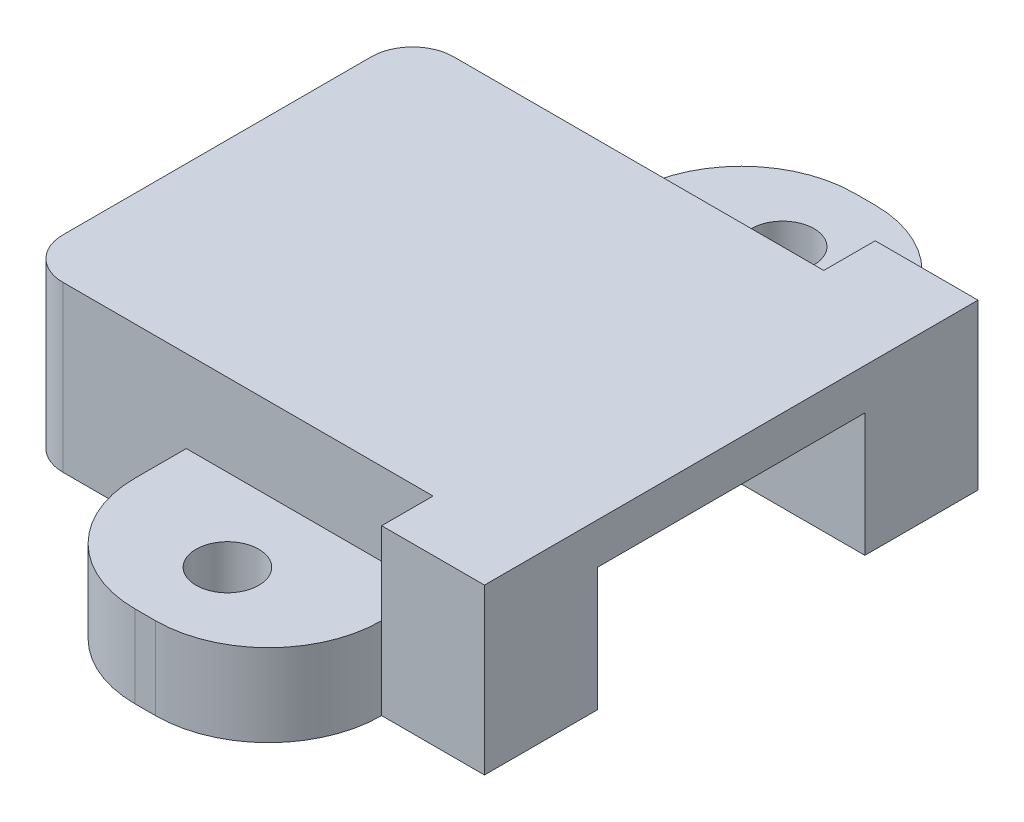
from build123d import *

# Parameters (mm, degrees)
SKETCH1_W           = 22
SKETCH1_H           = 13
BOSS_EXTRUDE1_DEPTH = 6
BOSS_EXTRUDE2_DEPTH = 2
BOSS_EXTRUDE3_DEPTH = 8
SKETCH4_R           = 1.525
SKETCH4_R_2         = 1.524
CUT_EXTRUDE1_DEPTH  = 36.566838488
SKETCH5_W           = 9
SKETCH5_H           = 4.088652256
CUT_EXTRUDE2_DEPTH  = 38.735924528
FILLET1_R           = 2
SKETCH6_W           = 12
SKETCH6_H           = 13.009000019
SKETCH6_W_2         = 15.838286437
CUT_EXTRUDE3_DEPTH  = 4
SKETCH7_W           = 2.5
SKETCH7_H           = 8
BOSS_EXTRUDE5_DEPTH = 3
FILLET3_R           = 2.5
FILLET4_R           = 2.5
SKETCH9_W           = 24
SKETCH9_H           = 8
CUT_EXTRUDE5_DEPTH  = 3
BOSS_EXTRUDE6_REACH = 35.526
SKETCH10_W          = 5
SKETCH10_H          = 2.5


with BuildPart() as part:
    # Sketch1 → Boss-Extrude1 (new body)
    with BuildSketch(Plane(origin=(0, 0, 0), x_dir=(1, 0, 0), z_dir=(0, 1, 0))):
        with BuildLine():
            Line((-1, -3), (23, -3))
            Line((23, -3), (25, -3))
            Line((25, -3), (25, -1))
            Line((25, -1), (25, 14))
            Line((25, 14), (25, 16))
            Line((25, 16), (23, 16))
            Line((23, 16), (-1, 16))
            ThreePointArc((-1, 16), (-2.414213562, 15.414213562), (-3, 14))
            Line((-3, 14), (-3, -1))
            ThreePointArc((-3, -1), (-2.414213562, -2.414213562), (-1, -3))
        make_face()
        with Locations((11, 6.5)):
            Rectangle(SKETCH1_W, SKETCH1_H, mode=Mode.SUBTRACT)
    extrude(amount=BOSS_EXTRUDE1_DEPTH)

    # Sketch2 → Boss-Extrude2 (add)
    with BuildSketch(Plane(origin=(0, 6, 0), x_dir=(1, 0, 0), z_dir=(0, 1, 0))):
        with BuildLine():
            Line((25, 14), (25, -1))
            Line((25, -1), (25, -3))
            Line((25, -3), (23, -3))
            Line((23, -3), (-1, -3))
            ThreePointArc((-1, -3), (-2.414213562, -2.414213562), (-3, -1))
            Line((-3, -1), (-3, 14))
            ThreePointArc((-3, 14), (-2.414213562, 15.414213562), (-1, 16))
            Line((-1, 16), (23, 16))
            Line((23, 16), (25, 16))
            Line((25, 16), (25, 14))
        make_face()
    extrude(amount=BOSS_EXTRUDE2_DEPTH)

    # Sketch3 → Boss-Extrude3 (add)
    with BuildSketch(Plane.XZ):
        with BuildLine():
            Line((5, 3), (17, 3))
            Line((17, 3), (17, 5.5))
            ThreePointArc((17, 5.5), (15.389087297, 9.389087297), (11.5, 11))
            Line((11.5, 11), (10.5, 11))
            ThreePointArc((10.5, 11), (6.610912703, 9.389087297), (5, 5.5))
            Line((5, 5.5), (5, 3))
        make_face()
        with BuildLine():
            Line((17, -16), (5, -16))
            Line((5, -16), (5, -18.5))
            ThreePointArc((5, -18.5), (6.610912703, -22.389087297), (10.5, -24))
            Line((10.5, -24), (11.5, -24))
            ThreePointArc((11.5, -24), (15.389087297, -22.389087297), (17, -18.5))
            Line((17, -18.5), (17, -16))
        make_face()
    extrude(amount=-BOSS_EXTRUDE3_DEPTH)

    # Sketch4 → Cut-Extrude1 (cut, through all)
    with BuildSketch(Plane(origin=(0, 0, 0), x_dir=(-1, 0, 0), z_dir=(0, -1, 0))):
        with Locations(Location((-11, 20, 0), (0, 0, 90))):
            Circle(SKETCH4_R)
        with Locations(Location((-11, -7, 0), (0, 0, 90))):
            Circle(SKETCH4_R_2)
    extrude(amount=-CUT_EXTRUDE1_DEPTH, mode=Mode.SUBTRACT)

    # Sketch5 → Cut-Extrude2 (cut, through all)
    with BuildSketch(Plane(origin=(25, 0, 0), x_dir=(0, 0, -1), z_dir=(1, 0, 0))):
        with Locations((6.5, 2.044326128)):
            Rectangle(SKETCH5_W, SKETCH5_H)
    extrude(amount=-CUT_EXTRUDE2_DEPTH, mode=Mode.SUBTRACT)

    # Fillet1
    fillet1_edges = [part.edges().sort_by_distance(p)[0] for p in [
        (-1.5, 4.088652256, -11),
        (-1.5, 4.088652256, -2),
        (23.5, 4.088652256, -11),
        (23.5, 4.088652256, -2),
    ]]
    fillet(fillet1_edges, radius=FILLET1_R)

    # Sketch6 → Cut-Extrude3 (cut)
    with BuildSketch(Plane(origin=(0, 8, 0), x_dir=(1, 0, 0), z_dir=(0, 1, 0))):
        with Locations((11, 22.504500009)):
            Rectangle(SKETCH6_W, SKETCH6_H)
        with Locations((11.149066226, -9.50450001)):
            Rectangle(SKETCH6_W_2, SKETCH6_H)
    extrude(amount=-CUT_EXTRUDE3_DEPTH, mode=Mode.SUBTRACT)

    # Sketch7 → Boss-Extrude5 (add)
    with BuildSketch(Plane(origin=(25, 0, 0), x_dir=(0, 0, -1), z_dir=(1, 0, 0))):
        with Locations((17.25, 4)):
            Rectangle(SKETCH7_W, SKETCH7_H)
        with Locations((-4.25, 4)):
            Rectangle(SKETCH7_W, SKETCH7_H)
    extrude(amount=-BOSS_EXTRUDE5_DEPTH)

    # Fillet3
    fillet3_edges = [part.edges().sort_by_distance(p)[0] for p in [
        (22, 4, -16),
    ]]
    fillet(fillet3_edges, radius=FILLET3_R - 0.0001)  # a hair under: the kernel refuses the full size

    # Fillet4
    fillet4_edges = [part.edges().sort_by_distance(p)[0] for p in [
        (22, 4, 3),
    ]]
    fillet(fillet4_edges, radius=FILLET4_R - 0.0001)  # a hair under: the kernel refuses the full size

    # Sketch9 → Cut-Extrude5 (cut)
    with BuildSketch(Plane(origin=(25, 0, 0), x_dir=(0, 0, -1), z_dir=(1, 0, 0))):
        with Locations((6.5, 4)):
            Rectangle(SKETCH9_W, SKETCH9_H)
    extrude(amount=-CUT_EXTRUDE5_DEPTH, mode=Mode.SUBTRACT)

    # Boss-Extrude6: up to this face of the body (flat: up to its plane)
    boss_extrude6_end = Plane(part.part.faces().sort_by_distance((9.97036164, 0, 3.836684907))[0])
    # Sketch10 → Boss-Extrude6 (add, up to the picked face)
    with BuildSketch(Plane(origin=(0, 8, 0), x_dir=(1, 0, 0), z_dir=(0, 1, 0)), mode=Mode.PRIVATE) as boss_extrude6_sk1:
        with Locations((19.5, 17.25)):
            Rectangle(SKETCH10_W, SKETCH10_H)
    boss_extrude6_tool1 = split(extrude(boss_extrude6_sk1.sketch, amount=-BOSS_EXTRUDE6_REACH, mode=Mode.PRIVATE), bisect_by=boss_extrude6_end, keep=Keep.BOTH, mode=Mode.PRIVATE)
    # Sketch10 → Boss-Extrude6 (add, up to the picked face)
    with BuildSketch(Plane(origin=(0, 8, 0), x_dir=(1, 0, 0), z_dir=(0, 1, 0)), mode=Mode.PRIVATE) as boss_extrude6_sk2:
        with Locations((19.5, -4.25)):
            Rectangle(SKETCH10_W, SKETCH10_H)
    boss_extrude6_tool2 = split(extrude(boss_extrude6_sk2.sketch, amount=-BOSS_EXTRUDE6_REACH, mode=Mode.PRIVATE), bisect_by=boss_extrude6_end, keep=Keep.BOTH, mode=Mode.PRIVATE)
    add(boss_extrude6_tool1.solids().sort_by(Axis((19.5, 8, -17.25), (0, -1, 0)))[0])
    add(boss_extrude6_tool2.solids().sort_by(Axis((19.5, 8, 4.25), (0, -1, 0)))[0])


solid = part.part
